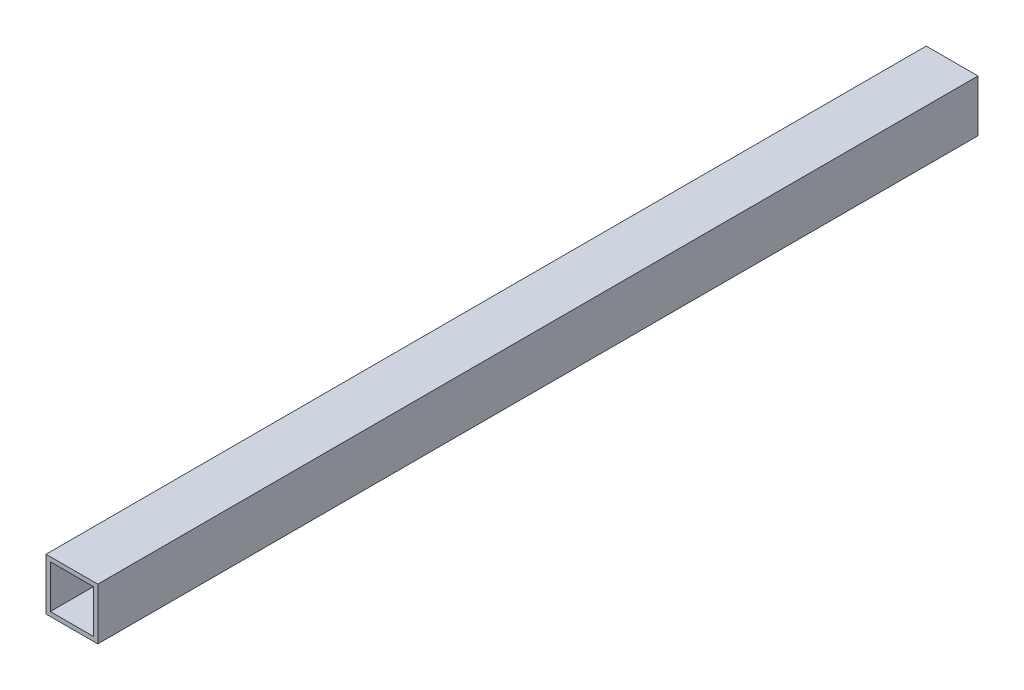
from build123d import *

# Parameters (mm, degrees)
SKETCH1_W           = 19.05
SKETCH1_H           = 19.05
SKETCH1_W_2         = 15.875
SKETCH1_H_2         = 15.875
BOSS_EXTRUDE1_DEPTH = 161.925


with BuildPart() as part:
    # Sketch1 → Boss-Extrude1 (new, symmetric)
    with BuildSketch(Plane.XY):
        Rectangle(SKETCH1_W, SKETCH1_H)
        Rectangle(SKETCH1_W_2, SKETCH1_H_2, mode=Mode.SUBTRACT)
    extrude(amount=BOSS_EXTRUDE1_DEPTH, both=True)


solid = part.part
